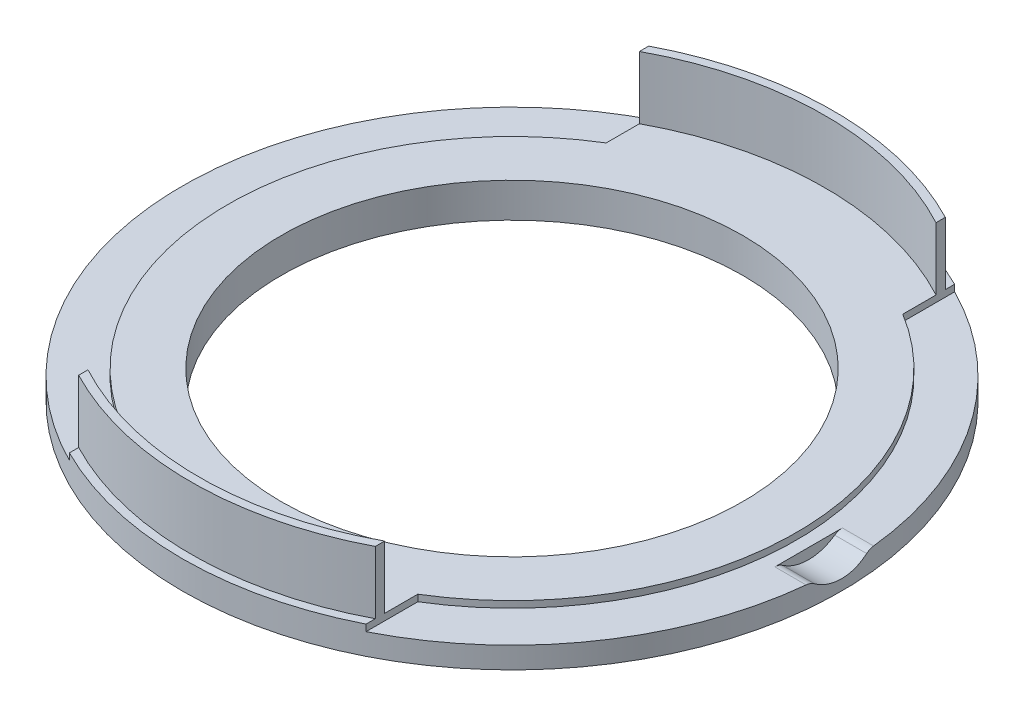
from build123d import *

# Parameters (mm, degrees)
SKETCH1_R                = 20
SKETCH1_R_2              = 14
BOSS_EXTRUDE1_DEPTH      = 1.3
BOSS_EXTRUDE2_DEPTH      = 0.4
BOSS_EXTRUDE2_DEPTH_BACK = 1.7
SKETCH2_R                = 17.25
SKETCH2_R_2              = 14
BOSS_EXTRUDE3_DEPTH      = 0.4
SKETCH4_R                = 2.75
CUT_EXTRUDE1_DEPTH       = 2
FILLET1_R                = 0.8
BOSS_EXTRUDE4_DEPTH      = 3.8


with BuildPart() as part:
    # Sketch1 → Boss-Extrude1 (new body)
    with BuildSketch(Plane(origin=(0, 0, 0), x_dir=(1, 0, 0), z_dir=(0, 1, 0))):
        Circle(SKETCH1_R)
        Circle(SKETCH1_R_2, mode=Mode.SUBTRACT)
    extrude(amount=BOSS_EXTRUDE1_DEPTH)

    # Sketch2 → Boss-Extrude2 (add, two sides: drawn at the far end of the back side and taken through both)
    with BuildSketch(Plane.XZ.offset(-BOSS_EXTRUDE2_DEPTH_BACK)):
        Circle(SKETCH2_R)
        Circle(SKETCH2_R_2, mode=Mode.SUBTRACT)
    extrude(amount=BOSS_EXTRUDE2_DEPTH + BOSS_EXTRUDE2_DEPTH_BACK)

    # Sketch3 → Boss-Extrude3 (add)
    with BuildSketch(Plane(origin=(0, 1.3, 0), x_dir=(1, 0, 0), z_dir=(0, 1, 0))):
        with BuildLine():
            Line((6.735354, 12.273345), (9, 12.273345))
            Line((9, 12.273345), (9, 17.860571))
            ThreePointArc((9, 17.860571), (0, 20), (-9, 17.860571))
            Line((-9, 17.860571), (-9, 12.273345))
            Line((-9, 12.273345), (-6.735354, 12.273345))
            ThreePointArc((-6.735354, 12.273345), (0, 14), (6.735354, 12.273345))
        make_face()
        with BuildLine():
            Line((-9, -11.497912), (-7.987366, -11.497912))
            ThreePointArc((-7.987366, -11.497912), (0, -14), (7.987366, -11.497912))
            Line((7.987366, -11.497912), (9, -11.497912))
            Line((9, -11.497912), (9, -17.860571))
            ThreePointArc((9, -17.860571), (0, -20), (-9, -17.860571))
            Line((-9, -17.860571), (-9, -11.497912))
        make_face()
    extrude(amount=BOSS_EXTRUDE3_DEPTH)

    # Sketch4 → Cut-Extrude1 (cut)
    with BuildSketch(Plane(origin=(20, 0, 0), x_dir=(0, 0, -1), z_dir=(1, 0, 0))):
        with Locations((0, 3.4)):
            Circle(SKETCH4_R)
    extrude(amount=-CUT_EXTRUDE1_DEPTH, mode=Mode.SUBTRACT)

    # Fillet1
    fillet1_edges = [part.edges().sort_by_distance(p)[0] for p in [
        (18.960516, 1.3, 1.775528),
        (18.960516, 1.3, -1.775528),
    ]]
    fillet(fillet1_edges, radius=FILLET1_R)

    # Sketch5 → Boss-Extrude4 (add)
    with BuildSketch(Plane(origin=(0, 1.7, 0), x_dir=(1, 0, 0), z_dir=(0, 1, 0))):
        with BuildLine():
            Line((9, -17.298844), (9, -16.733201))
            ThreePointArc((9, -16.733201), (0, -19), (-9, -16.733201))
            Line((-9, -16.733201), (-9, -17.298844))
            ThreePointArc((-9, -17.298844), (0, -19.5), (9, -17.298844))
        make_face()
        with BuildLine():
            Line((9, 16.733201), (9, 17.298844))
            ThreePointArc((9, 17.298844), (0, 19.5), (-9, 17.298844))
            Line((-9, 17.298844), (-9, 16.733201))
            ThreePointArc((-9, 16.733201), (0, 19), (9, 16.733201))
        make_face()
    extrude(amount=BOSS_EXTRUDE4_DEPTH)


solid = part.part
